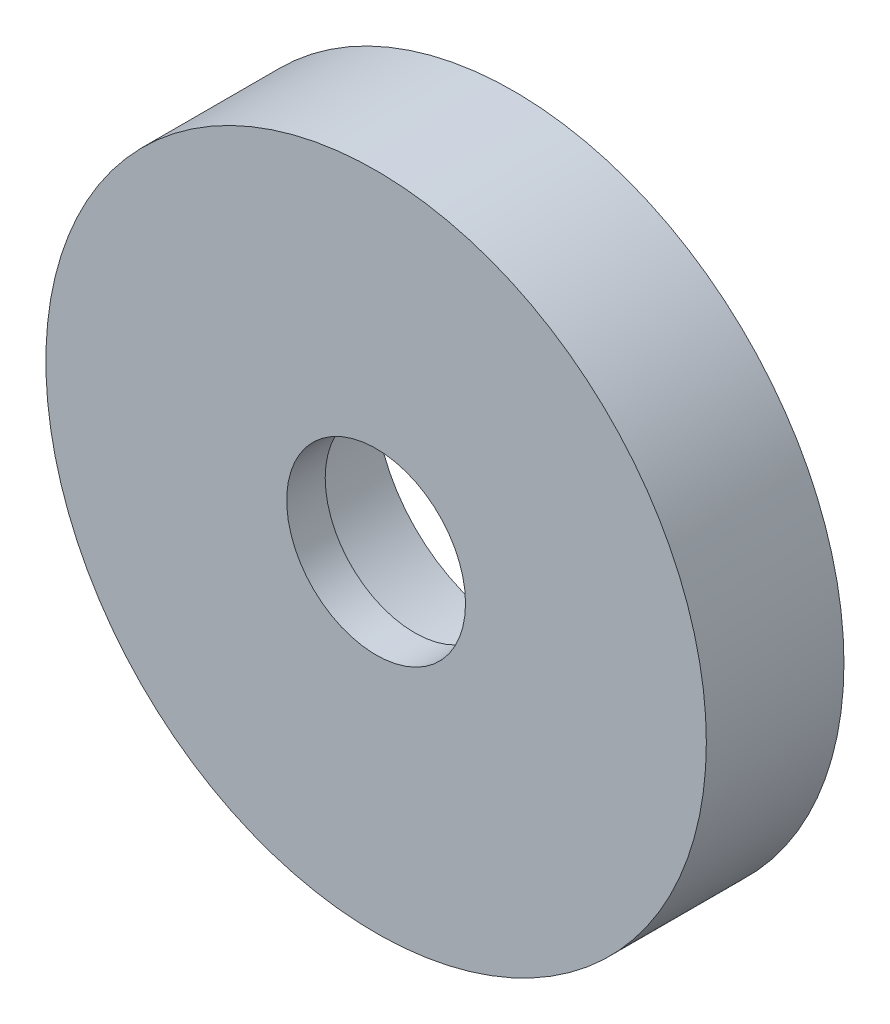
from build123d import *

# Parameters (mm, degrees)
SKETCH1_R               = 19.05
SKETCH1_R_2             = 8.001
BOSS_EXTRUDE1_DEPTH     = 3.175
BOSS_EXTRUDE2_START     = 4.7625
SKETCH2_R               = 19.05
BOSS_EXTRUDE2_DEPTH     = 4.7625
F_3_8_CLEARANCE_HOLE1_D = 10.31748
CUT_EXTRUDE1_START      = -2.54
SKETCH6_R               = 8.001
CUT_EXTRUDE1_DEPTH      = 2.54


with BuildPart() as part:
    # Sketch1 → Boss-Extrude1 (new body)
    with BuildSketch(Plane.XY):
        with Locations((95.864074702, 45.465579041)):
            Circle(SKETCH1_R)
        with Locations((95.864074702, 45.465579041)):
            Circle(SKETCH1_R_2, mode=Mode.SUBTRACT)
    extrude(amount=-BOSS_EXTRUDE1_DEPTH)

    # Sketch2 → Boss-Extrude2 (add)
    with BuildSketch(Plane.XY.offset(BOSS_EXTRUDE2_START)):
        with Locations((95.864074702, 45.465579041)):
            Circle(SKETCH2_R)
    extrude(amount=-BOSS_EXTRUDE2_DEPTH)

    # 3/8 Clearance Hole1 (through all)
    with Locations(Plane.XY.offset(4.7625)):
        with Locations((95.864074702, 45.465579041)):
            Hole(F_3_8_CLEARANCE_HOLE1_D / 2)

    # Sketch6 → Cut-Extrude1 (cut)
    with BuildSketch(Plane(origin=(0, 0, 0), x_dir=(-1, 0, 0), z_dir=(0, 0, -1)).offset(CUT_EXTRUDE1_START)):
        with Locations((-95.864074702, 45.465579041)):
            Circle(SKETCH6_R)
    extrude(amount=CUT_EXTRUDE1_DEPTH, mode=Mode.SUBTRACT)


solid = part.part
